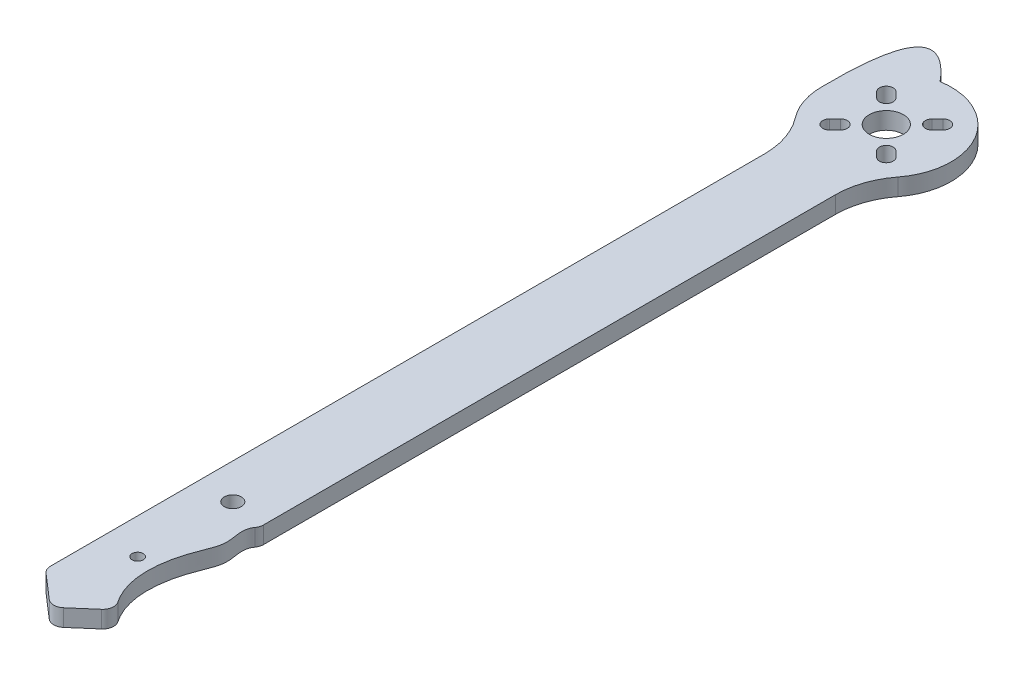
from build123d import *

# Parameters (mm, degrees)
SKETCH1_R           = 1.984375
SKETCH1_R_2         = 1.28984375
SKETCH1_R_3         = 3.96875
BOSS_EXTRUDE1_DEPTH = 1.984375
FILLET1_R           = 17.78
FILLET3_R           = 2.54


with BuildPart() as part:
    # Sketch1 → Boss-Extrude1 (new, symmetric)
    with BuildSketch(Plane(origin=(0, 0, 0), x_dir=(1, 0, 0), z_dir=(0, 1, 0))):
        with BuildLine():
            Line((-8.23515625, 7.14375), (0, 0))
            Line((0, 0), (8.23515625, 7.14375))
            add(Edge.make_bspline(
                [(8.23515625, 40.443948044), (6.159687598, 38.377819464), (8.448476078, 34.077670659), (3.312171003, 23.230566431), (2.764162785, 13.194656625), (8.23515625, 7.14375)],
                knots=[0, 0, 0, 0, 0.202237808, 0.355835727, 1, 1, 1, 1], degree=3))
            Line((8.23515625, 40.443948044), (8.23515625, 181.834419662))
            ThreePointArc((8.23515625, 181.834419662), (14.070276721, 199.897508103), (-2.385158903, 209.360194476))
            add(Edge.make_bspline(
                [(-15.08125, 194.46875), (-15.572644056, 225.099567963), (-2.385158903, 209.360194476)],
                knots=[0, 0, 0, 1, 1, 1], degree=2))
            ThreePointArc((-15.08125, 194.46875), (-13.259723824, 187.283777788), (-8.23515625, 181.834419662))
            Line((-8.23515625, 181.834419662), (-8.23515625, 7.14375))
        make_face()
        with Locations((0, 42.465625)):
            Circle(SKETCH1_R, mode=Mode.SUBTRACT)
        with Locations((0, 20.33984375)):
            Circle(SKETCH1_R_2, mode=Mode.SUBTRACT)
        with Locations((0, 194.46875)):
            Circle(SKETCH1_R_3, mode=Mode.SUBTRACT)
        with BuildLine():
            ThreePointArc((-4.209495057, 200.923309087), (-4.209495057, 198.678245057), (-6.454559087, 198.678245057))
            Line((-6.454559087, 198.678245057), (-7.717407604, 199.941093574))
            ThreePointArc((-7.717407604, 199.941093574), (-7.717407604, 202.186157604), (-5.472343574, 202.186157604))
            Line((-5.472343574, 202.186157604), (-4.209495057, 200.923309087))
        make_face(mode=Mode.SUBTRACT)
        with BuildLine():
            Line((-7.717407604, 188.996406426), (-6.454559087, 190.259254943))
            ThreePointArc((-6.454559087, 190.259254943), (-4.209495057, 190.259254943), (-4.209495057, 188.014190913))
            Line((-4.209495057, 188.014190913), (-5.472343574, 186.751342396))
            ThreePointArc((-5.472343574, 186.751342396), (-7.717407604, 186.751342396), (-7.717407604, 188.996406426))
        make_face(mode=Mode.SUBTRACT)
        with BuildLine():
            ThreePointArc((5.472343574, 202.186157604), (7.717407604, 202.186157604), (7.717407604, 199.941093574))
            Line((7.717407604, 199.941093574), (6.454559087, 198.678245057))
            ThreePointArc((6.454559087, 198.678245057), (4.209495057, 198.678245057), (4.209495057, 200.923309087))
            Line((4.209495057, 200.923309087), (5.472343574, 202.186157604))
        make_face(mode=Mode.SUBTRACT)
        with BuildLine():
            ThreePointArc((4.209495057, 188.014190913), (4.209495057, 190.259254943), (6.454559087, 190.259254943))
            Line((6.454559087, 190.259254943), (7.717407604, 188.996406426))
            ThreePointArc((7.717407604, 188.996406426), (7.717407604, 186.751342396), (5.472343574, 186.751342396))
            Line((5.472343574, 186.751342396), (4.209495057, 188.014190913))
        make_face(mode=Mode.SUBTRACT)
    extrude(amount=BOSS_EXTRUDE1_DEPTH, both=True)

    # Fillet1
    fillet1_edges = [part.edges().sort_by_distance(p)[0] for p in [
        (-8.23515625, 0, -181.834419662),
        (8.23515625, 0, -181.834419662),
    ]]
    fillet(fillet1_edges, radius=FILLET1_R)

    # Fillet3
    fillet3_edges = [part.edges().sort_by_distance(p)[0] for p in [
        (8.23515625, -0.9921875, -40.443948044),
        (-8.23515625, 0, -7.14375),
        (0, 0, 0),
        (8.23515625, -0.9921875, -7.14375),
    ]]
    fillet(fillet3_edges, radius=FILLET3_R)


solid = part.part
